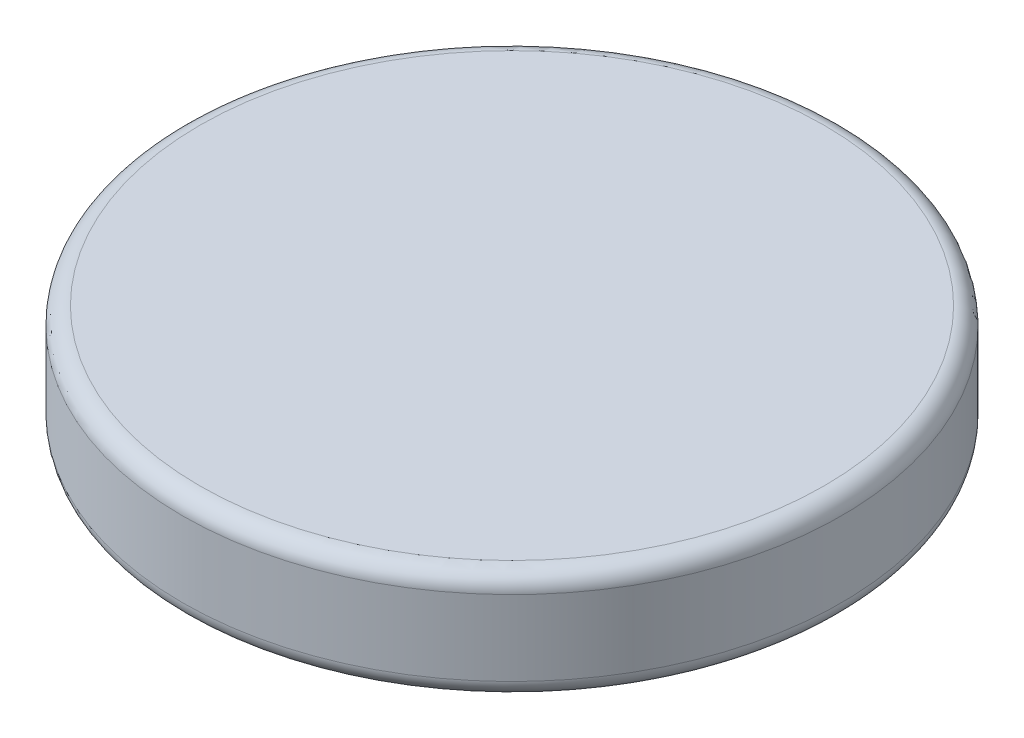
from build123d import *

# Parameters (mm, degrees)
SKETCH1_R           = 4.7625
BOSS_EXTRUDE1_DEPTH = 1.5875
FILLET1_R           = 0.25


with BuildPart() as part:
    # Sketch1 → Boss-Extrude1 (new body)
    with BuildSketch(Plane(origin=(0, 0, 0), x_dir=(1, 0, 0), z_dir=(0, 1, 0))):
        Circle(SKETCH1_R)
    extrude(amount=BOSS_EXTRUDE1_DEPTH)

    # Fillet1
    fillet1_edges = [part.edges().sort_by_distance(p)[0] for p in [
        (-4.7625, 0, 0),
        (-4.7625, 1.5875, 0),
    ]]
    fillet(fillet1_edges, radius=FILLET1_R)


solid = part.part
